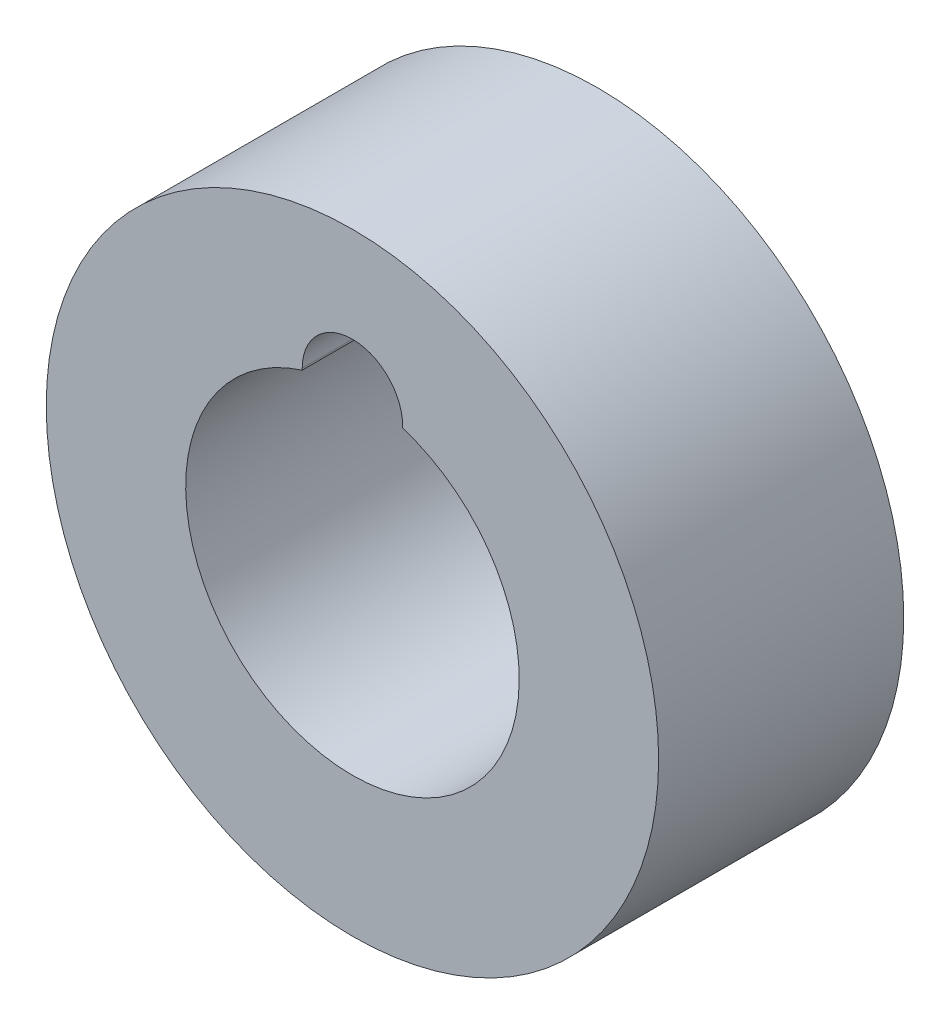
from build123d import *

# Parameters (mm, degrees)
CROQUIS1_R              = 7.62
CROQUIS1_R_2            = 4.15
SALIENTE_EXTRUIR1_DEPTH = 6.099999992
CORTAR_EXTRUIR1_DEPTH   = 13.383004478


with BuildPart() as part:
    # Croquis1 → Saliente-Extruir1 (new body)
    with BuildSketch(Plane.XY):
        Circle(CROQUIS1_R)
        Circle(CROQUIS1_R_2, mode=Mode.SUBTRACT)
    extrude(amount=SALIENTE_EXTRUIR1_DEPTH)

    # Croquis2 → Cortar-Extruir1 (cut, through all)
    with BuildSketch(Plane.XY.offset(6.099999992)):
        with BuildLine():
            Line((-1.25, 0), (-1.25, 4))
            ThreePointArc((-1.25, 4), (0, 5.25), (1.25, 4))
            Line((1.25, 4), (1.25, 0))
            ThreePointArc((1.25, 0), (0, -1.25), (-1.25, 0))
        make_face()
    extrude(amount=-CORTAR_EXTRUIR1_DEPTH, mode=Mode.SUBTRACT)


solid = part.part
